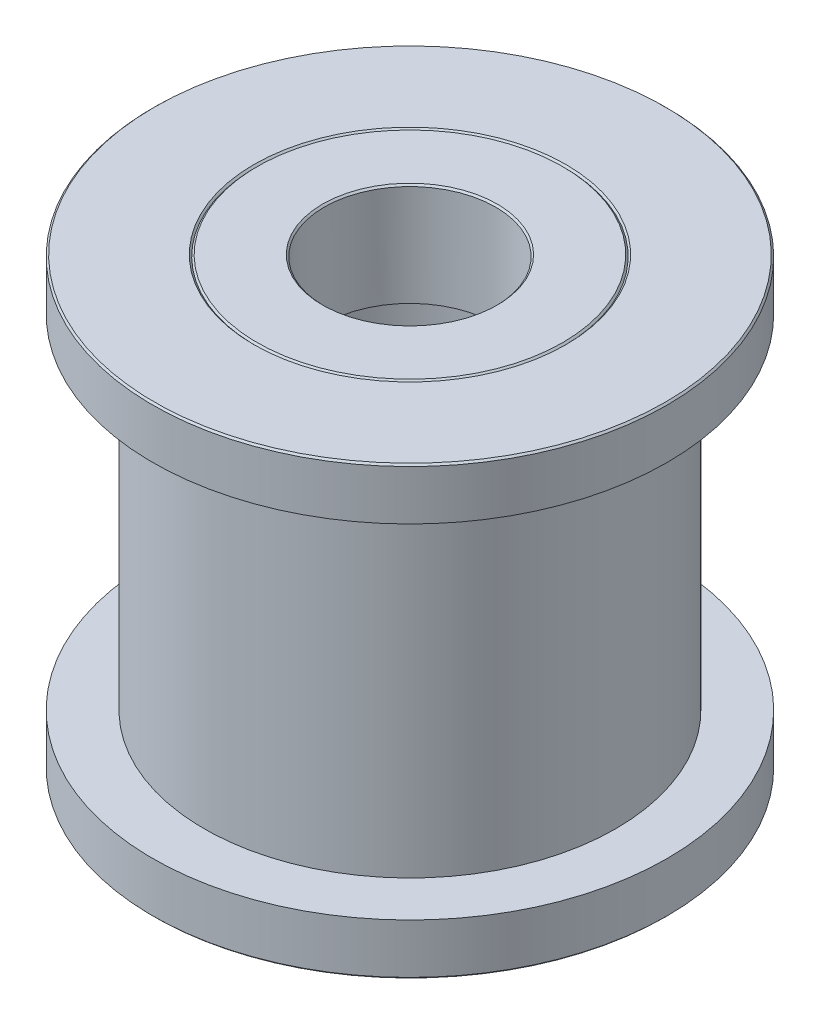
from build123d import *

# Parameters (mm, degrees)
CHAMFER1_SIZE = 0.05
SKETCH1_3_W   = 2
SKETCH1_3_H   = 3
CHAMFER2_SIZE = 0.05
CHAMFER3_SIZE = 0.05


with BuildPart() as part:
    # Sketch1 → Revolve1 (revolve)
    with BuildSketch(Plane.XY):
        Polygon((6, -7.075803982), (6, 2.924196018), (7.5, 2.924196018), (7.5, 4.424196018), (4.5, 4.424196018), (4.5, 1.424196018), (3.5, 1.424196018), (3.5, -5.575803982), (4.5, -5.575803982), (4.5, -8.575803982), (7.5, -8.575803982), (7.5, -7.075803982), align=None)
    revolve(axis=Axis((0, -12.88820827, 0), (0, 1, 0)))

    # Chamfer1
    chamfer1_edges = [part.edges().sort_by_distance(p)[0] for p in [
        (-4.5, -8.575803982, 0),
        (-4.5, 4.424196018, 0),
        (-7.5, 4.424196018, 0),
        (-7.5, -8.575803982, 0),
    ]]
    chamfer(chamfer1_edges, length=CHAMFER1_SIZE)


with BuildPart() as body_2:
    # Sketch1<3> → Revolve2 (revolve)
    with BuildSketch(Plane.XY):
        with Locations((3.5, 2.924196018)):
            Rectangle(SKETCH1_3_W, SKETCH1_3_H)
        with Locations((3.5, -7.075803982)):
            Rectangle(SKETCH1_3_W, SKETCH1_3_H)
    revolve(axis=Axis((0, -12.88820827, 0), (0, 1, 0)))

    # Chamfer2
    chamfer2_edges = [body_2.edges().sort_by_distance(p)[0] for p in [
        (-4.5, -8.575803982, 0),
        (-2.5, -8.575803982, 0),
    ]]
    chamfer(chamfer2_edges, length=CHAMFER2_SIZE)

    # Chamfer3
    chamfer3_edges = [body_2.edges().sort_by_distance(p)[0] for p in [
        (-4.5, 4.424196018, 0),
        (-2.5, 4.424196018, 0),
    ]]
    chamfer(chamfer3_edges, length=CHAMFER3_SIZE)


solid = Compound([part.part, body_2.part])
